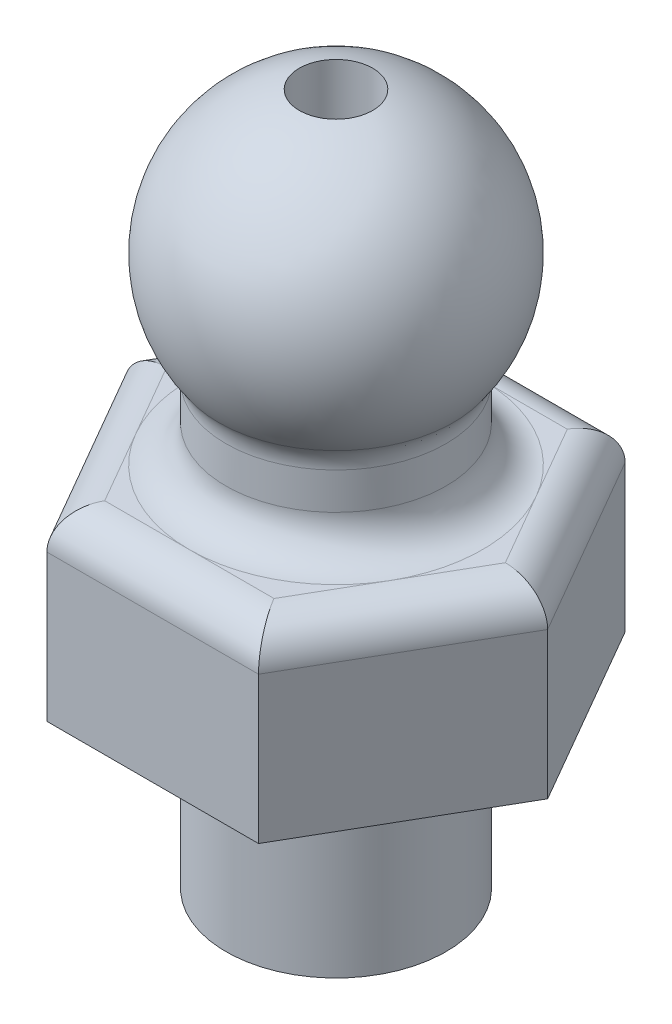
from build123d import *

# Parameters (mm, degrees)
SKETCH2_R          = 10.06808877
CUT_EXTRUDE1_DEPTH = 10
FILLET1_R          = 1
FILLET2_R          = 1
SKETCH3_W          = 1
SKETCH3_H          = 0.936459383
CUT_EXTRUDE2_DEPTH = 3
CIRPATTERN1_COUNT  = 6


with BuildPart() as part:
    # Sketch1 → Revolve1 (revolve)
    with BuildSketch(Plane.XY, mode=Mode.PRIVATE) as revolve1_sk:
        with BuildLine():
            Line((-1, 0), (-3, 0))
            Line((-3, 0), (-3, 5))
            Line((-3, 5), (-6, 5))
            Line((-6, 5), (-6, 10))
            Line((-6, 10), (-3, 10))
            Line((-3, 10), (-3, 12.354248689))
            ThreePointArc((-3, 12.354248689), (-3.824065295, 16.173253859), (-1, 18.872983346))
            Line((-1, 18.872983346), (-1, 16.732050808))
            ThreePointArc((-1, 16.732050808), (-1.732050808, 16), (-2, 15))
            Line((-2, 15), (-2, 7))
            Line((-2, 7), (-1, 7))
            Line((-1, 7), (-1, 0))
        make_face()
    revolve(revolve1_sk.sketch.rotate(Axis((0, 0, 0), (0, 1, 0)), 270), axis=Axis((0, 0, 0), (0, 1, 0)))

    # Sketch2 → Cut-Extrude1 (cut)
    with BuildSketch(Plane(origin=(0, 10, 0), x_dir=(1, 0, 0), z_dir=(0, 1, 0))):
        Circle(SKETCH2_R)
        Polygon((5.773502692, 0), (2.886751346, 5), (-2.886751346, 5), (-5.773502692, 0), (-2.886751346, -5), (2.886751346, -5), align=None, mode=Mode.SUBTRACT)
    extrude(amount=-CUT_EXTRUDE1_DEPTH, mode=Mode.SUBTRACT)

    # Fillet1
    fillet1_edges = [part.edges().sort_by_distance(p)[0] for p in [
        (0, 12.354248689, 3),
        (0, 10, 3),
    ]]
    fillet(fillet1_edges, radius=FILLET1_R)

    # Fillet2
    fillet2_edges = [part.edges().sort_by_distance(p)[0] for p in [
        (4.330127019, 10, 2.5),
        (0, 10, 5),
        (-4.330127019, 10, 2.5),
        (-4.330127019, 10, -2.5),
        (0, 10, -5),
        (4.330127019, 10, -2.5),
    ]]
    fillet(fillet2_edges, radius=FILLET2_R - 0.0001)  # a hair under: the kernel refuses the full size

    # Sketch3 → Cut-Extrude2 (cut)
    with BuildSketch(Plane(origin=(0, 10, 0), x_dir=(1, 0, 0), z_dir=(0, 1, 0))):
        with Locations((0, 1.831770309)):
            Rectangle(SKETCH3_W, SKETCH3_H)
    cut_extrude2 = extrude(amount=-CUT_EXTRUDE2_DEPTH, mode=Mode.SUBTRACT)

    # CirPattern1: Cut-Extrude2 ×6 about axis
    cirpattern1_axis = Axis((0, 0, 0), (0, 1, 0))
    for i in range(1, CIRPATTERN1_COUNT):
        add(cut_extrude2.rotate(cirpattern1_axis, i * 360 / CIRPATTERN1_COUNT), mode=Mode.SUBTRACT)


solid = part.part
